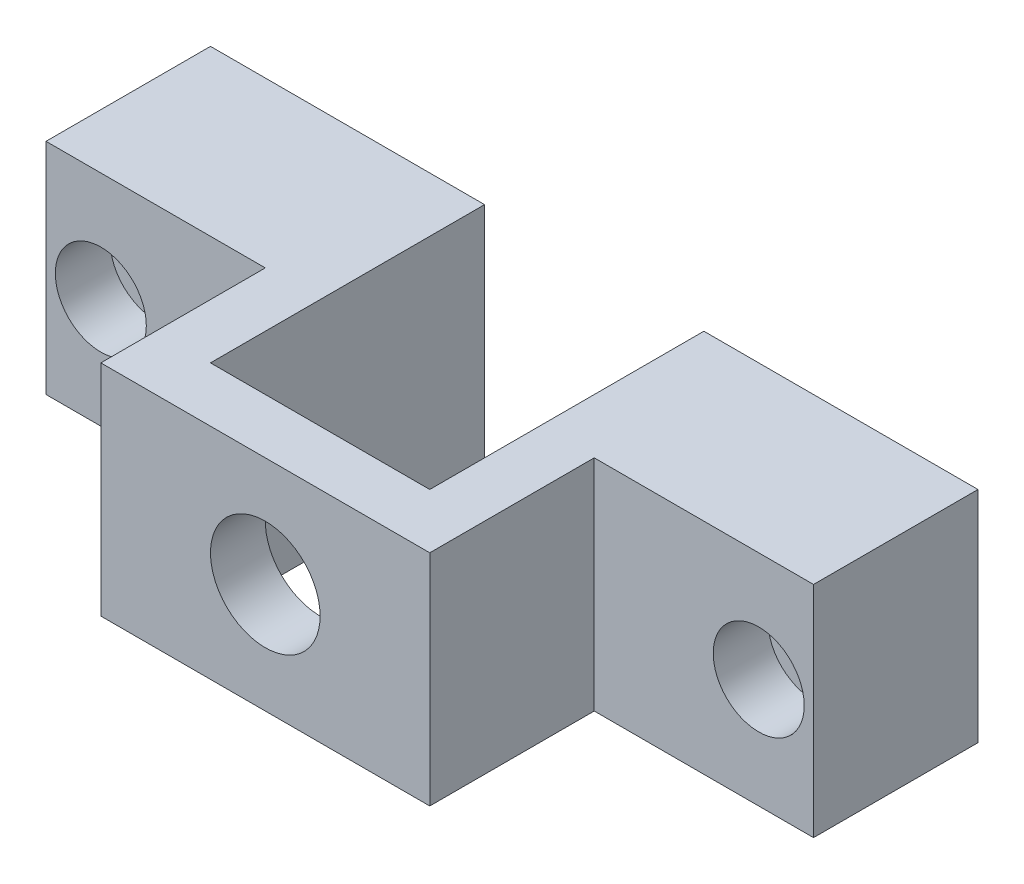
from build123d import *

# Parameters (mm, degrees)
SKETCH1_W           = 70
SKETCH1_H           = 20
SKETCH1_R           = 2.5
BOSS_EXTRUDE1_DEPTH = 15
SKETCH2_W           = 30
SKETCH2_H           = 20
BOSS_EXTRUDE2_DEPTH = 15
SKETCH4_W           = 20
SKETCH4_H           = 25
CUT_EXTRUDE1_DEPTH  = 79.74007874
SKETCH5_R           = 5
CUT_EXTRUDE2_DEPTH  = 79.74007874
SKETCH6_R           = 4.15
CUT_EXTRUDE3_DEPTH  = 5
SKETCH7_R           = 4.15
CUT_EXTRUDE4_DEPTH  = 5


with BuildPart() as part:
    # Sketch1 → Boss-Extrude1 (new body)
    with BuildSketch(Plane.XY):
        with Locations((35, 10)):
            Rectangle(SKETCH1_W, SKETCH1_H)
        with Locations((65, 10)):
            Circle(SKETCH1_R, mode=Mode.SUBTRACT)
        with Locations((5, 10)):
            Circle(SKETCH1_R, mode=Mode.SUBTRACT)
    extrude(amount=BOSS_EXTRUDE1_DEPTH)

    # Sketch2 → Boss-Extrude2 (add)
    with BuildSketch(Plane.XY.offset(15)):
        with Locations((35, 10)):
            Rectangle(SKETCH2_W, SKETCH2_H)
    extrude(amount=BOSS_EXTRUDE2_DEPTH)

    # Sketch4 → Cut-Extrude1 (cut, through all)
    with BuildSketch(Plane(origin=(0, 20, 0), x_dir=(1, 0, 0), z_dir=(0, 1, 0))):
        with Locations((35, -12.5)):
            Rectangle(SKETCH4_W, SKETCH4_H)
    extrude(amount=-CUT_EXTRUDE1_DEPTH, mode=Mode.SUBTRACT)

    # Sketch5 → Cut-Extrude2 (cut, through all)
    with BuildSketch(Plane.XY.offset(30)):
        with Locations((35, 10)):
            Circle(SKETCH5_R)
    extrude(amount=-CUT_EXTRUDE2_DEPTH, mode=Mode.SUBTRACT)

    # Sketch6 → Cut-Extrude3 (cut)
    with BuildSketch(Plane.XY.offset(15)):
        with Locations((5, 10)):
            Circle(SKETCH6_R)
    extrude(amount=-CUT_EXTRUDE3_DEPTH, mode=Mode.SUBTRACT)

    # Sketch7 → Cut-Extrude4 (cut)
    with BuildSketch(Plane.XY.offset(15)):
        with Locations((65, 10)):
            Circle(SKETCH7_R)
    extrude(amount=-CUT_EXTRUDE4_DEPTH, mode=Mode.SUBTRACT)


solid = part.part
